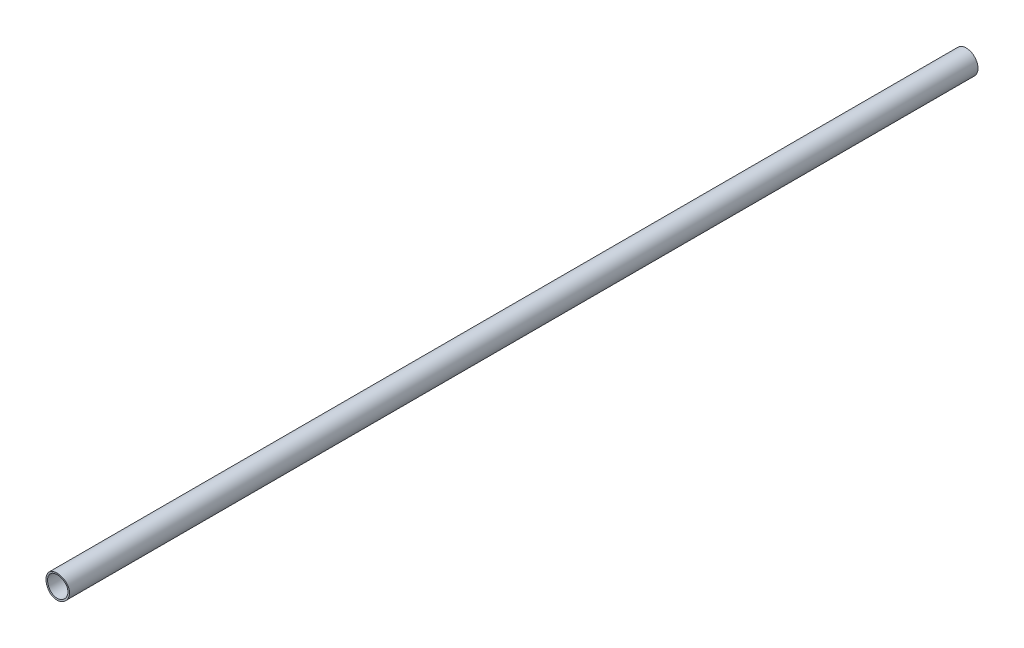
from build123d import *

# Parameters (mm, degrees)
SKETCH1_R               = 19.05
BOSS_EXTRUDE1_DEPTH     = 1524
SHELL1_T                = -2.54
CUT_EXTRUDE1_DEPTH      = 127
CUT_EXTRUDE1_DEPTH_BACK = 127
SKETCH2_R               = 136.09612354


with BuildPart() as part:
    # Sketch1 → Boss-Extrude1 (new body)
    with BuildSketch(Plane.XY):
        Circle(SKETCH1_R)
    extrude(amount=BOSS_EXTRUDE1_DEPTH)

    # Shell1
    shell1_openings = [part.faces().sort_by_distance(p)[0] for p in [
        (0, 0, 0),
    ]]
    offset(amount=SHELL1_T, openings=shell1_openings, kind=Kind.INTERSECTION)

    # Sketch2 → Cut-Extrude1 (cut, two sides: drawn at the far end of the back side and taken through both)
    with BuildSketch(Plane(origin=(0, 0, 0), x_dir=(0, 0, -1), z_dir=(1, 0, 0)).offset(-CUT_EXTRUDE1_DEPTH_BACK)):
        with Locations((-1608.283455196, 0)):
            Circle(SKETCH2_R)
    extrude(amount=CUT_EXTRUDE1_DEPTH + CUT_EXTRUDE1_DEPTH_BACK, mode=Mode.SUBTRACT)


solid = part.part
